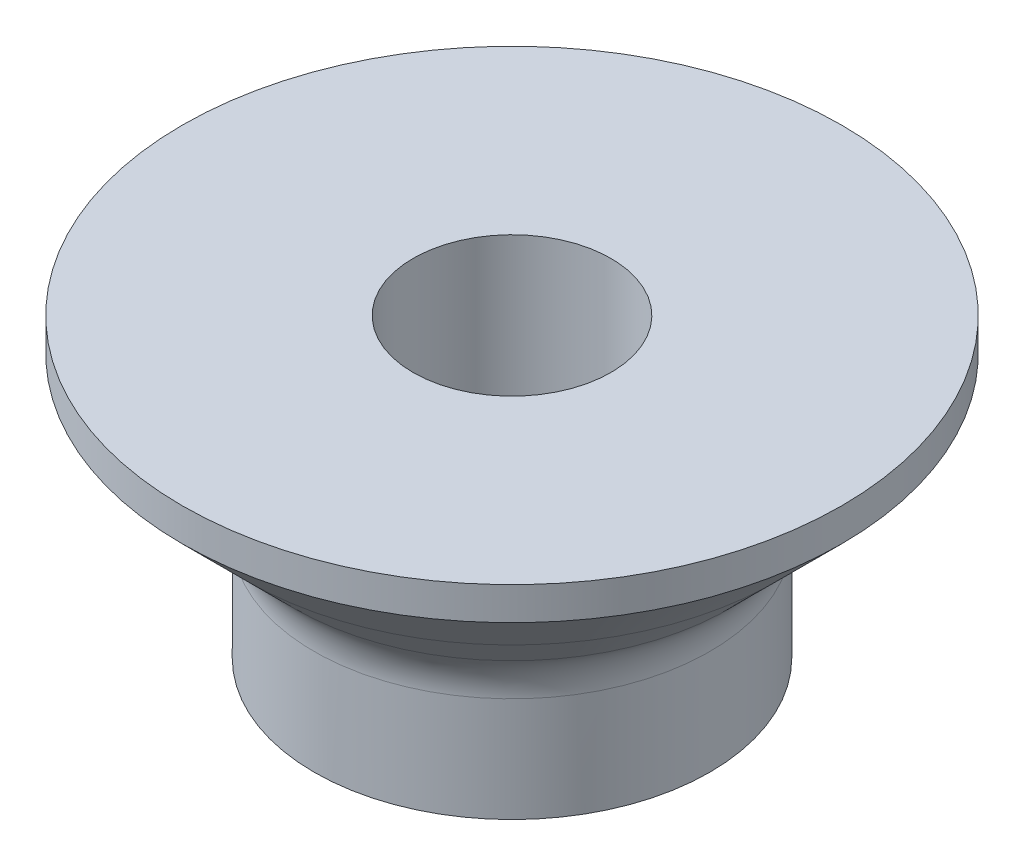
from build123d import *

# Parameters (mm, degrees)
SKETCH1_R           = 6
SKETCH1_R_2         = 3
BOSS_EXTRUDE1_DEPTH = 9
BOSS_EXTRUDE2_START = -3
SKETCH2_R           = 10
SKETCH2_R_2         = 3
BOSS_EXTRUDE2_DEPTH = 3
CHAMFER1_SIZE       = 2
FILLET1_R           = 2


with BuildPart() as part:
    # Sketch1 → Boss-Extrude1 (new body)
    with BuildSketch(Plane(origin=(0, 0, 0), x_dir=(1, 0, 0), z_dir=(0, 1, 0))):
        with Locations(Location((0, 0, 0), (0, 0, 270))):
            Circle(SKETCH1_R)
        with Locations(Location((0, 0, 0), (0, 0, 270))):
            Circle(SKETCH1_R_2, mode=Mode.SUBTRACT)
    extrude(amount=BOSS_EXTRUDE1_DEPTH)

    # Sketch2 → Boss-Extrude2 (add)
    with BuildSketch(Plane(origin=(0, 9, 0), x_dir=(1, 0, 0), z_dir=(0, 1, 0)).offset(BOSS_EXTRUDE2_START)):
        with Locations(Location((0, 0, 0), (0, 0, 270))):
            Circle(SKETCH2_R)
        with Locations(Location((0, 0, 0), (0, 0, 270))):
            Circle(SKETCH2_R_2, mode=Mode.SUBTRACT)
    extrude(amount=BOSS_EXTRUDE2_DEPTH)

    # Chamfer1
    chamfer1_edges = [part.edges().sort_by_distance(p)[0] for p in [
        (0, 6, -6),
        (0, 6, -10),
    ]]
    chamfer(chamfer1_edges, length=CHAMFER1_SIZE - 0.0001)  # a hair under: the kernel refuses the full size

    # Fillet1
    fillet1_edges = [part.edges().sort_by_distance(p)[0] for p in [
        (0, 4.0001, -6),
    ]]
    fillet(fillet1_edges, radius=FILLET1_R)


solid = part.part
